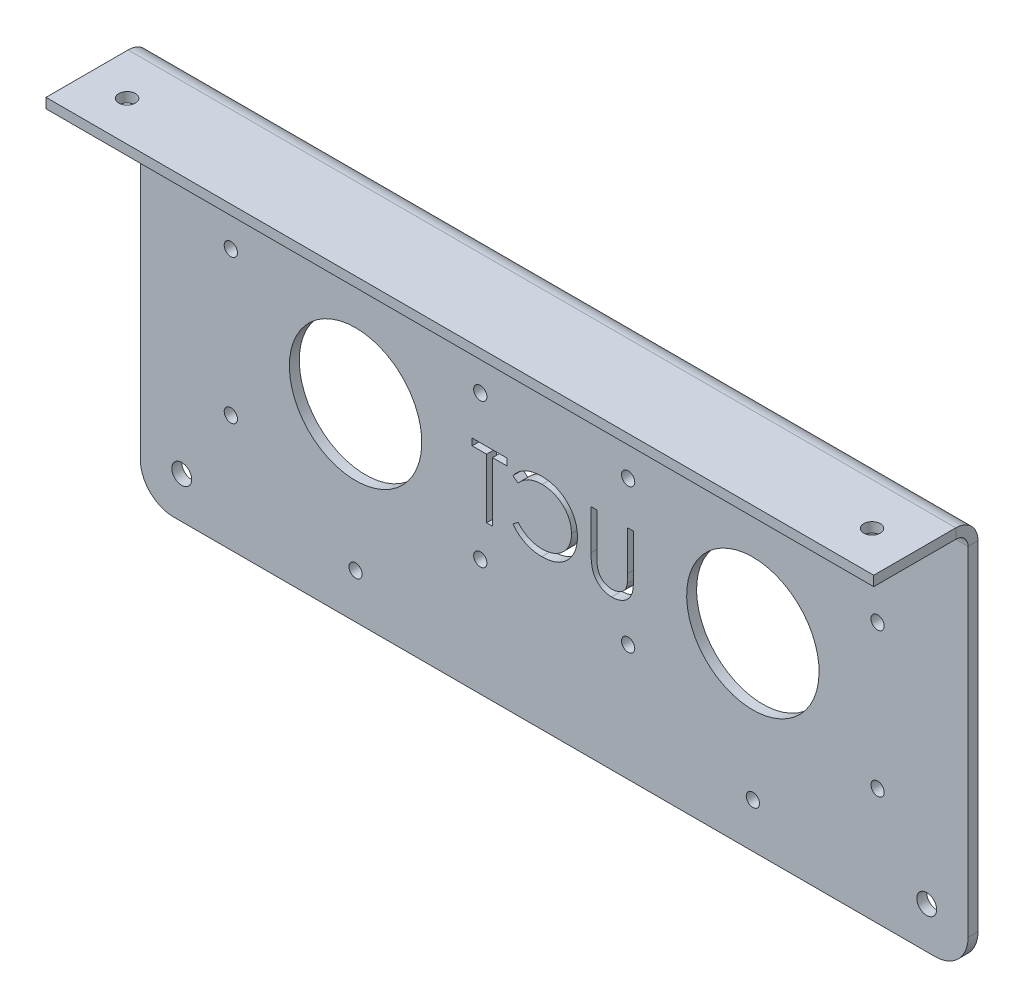
from build123d import *

# Parameters (mm, degrees)
BOSS_EXTRUDE1_DEPTH          = 125
SKETCH2_R                    = 2
SKETCH2_R_2                  = 20
CUT_EXTRUDE1_DEPTH           = 144.272685813
FILLET1_R                    = 10
SKETCH3_R                    = 2.5
CUT_EXTRUDE2_DEPTH           = 10
SKETCH4_R                    = 2.5
CUT_EXTRUDE3_DEPTH           = 10
BASE_FLANGE1_START           = -3
BASE_FLANGE1_DEPTH           = 3
EDGE_FLANGE1_STRIP_W         = 19.4
EDGE_FLANGE1_STRIP_H         = 3
EDGE_FLANGE1_STRIP_CUT_DEPTH = 250
EDGE_FLANGE1_DEPTH           = 250
SKETCH18_R                   = 3
SKETCH18_R_2                 = 2
SKETCH18_R_3                 = 20
CUT_EXTRUDE5_DEPTH           = 10
SKETCH19_R                   = 2.5
CUT_EXTRUDE6_DEPTH           = 10
CUT_EXTRUDE4_DEPTH           = 10


# Read off the part's stored shape, not the designer's step: Base-Flange1
# Sheet-metal steps are written as plain solids
with BuildPart() as part:
    # Sketch1 → Boss-Extrude1 (new, symmetric)
    with BuildSketch(Plane(origin=(0, 0, 0), x_dir=(0, 0, -1), z_dir=(1, 0, 0))):
        with BuildLine():
            Line((-30.75, 61.75), (-5.75, 61.75))
            ThreePointArc((-5.75, 61.75), (-0.093145751, 59.406854249), (2.25, 53.75))
            Line((2.25, 53.75), (2.25, -53.25))
            Line((2.25, -53.25), (-2.25, -53.25))
            Line((-2.25, -53.25), (-2.25, 53.25))
            ThreePointArc((-2.25, 53.25), (-3.421572875, 56.078427125), (-6.25, 57.25))
            Line((-6.25, 57.25), (-30.75, 57.25))
            Line((-30.75, 57.25), (-30.75, 61.75))
        make_face()
    extrude(amount=BOSS_EXTRUDE1_DEPTH, both=True)

    # Sketch2 → Cut-Extrude1 (cut, through all)
    with BuildSketch(Plane(origin=(0, 0, -2.25), x_dir=(-1, 0, 0), z_dir=(0, 0, -1))):
        with Locations(Location((60, 47.25, 0), (0, 0, 90))):
            Circle(SKETCH2_R)
        with Locations(Location((97.672105065, 25.5, 0), (0, 0, 90))):
            Circle(SKETCH2_R)
        with Locations(Location((97.672105065, -18, 0), (0, 0, 90))):
            Circle(SKETCH2_R)
        with Locations(Location((60, -39.75, 0), (0, 0, 90))):
            Circle(SKETCH2_R)
        with Locations(Location((22.327894935, -18, 0), (0, 0, 90))):
            Circle(SKETCH2_R)
        with Locations(Location((22.327894935, 25.5, 0), (0, 0, 90))):
            Circle(SKETCH2_R)
        with Locations(Location((60, 3.75, 0), (0, 0, 90))):
            Circle(SKETCH2_R_2)
        with Locations(Location((-60, 3.75, 0), (0, 0, 90))):
            Circle(SKETCH2_R_2)
        with Locations(Location((-22.327894935, 25.5, 0), (0, 0, 90))):
            Circle(SKETCH2_R)
        with Locations(Location((-22.327894935, -18, 0), (0, 0, 90))):
            Circle(SKETCH2_R)
        with Locations(Location((-60, -39.75, 0), (0, 0, 90))):
            Circle(SKETCH2_R)
        with Locations(Location((-97.672105065, -18, 0), (0, 0, 90))):
            Circle(SKETCH2_R)
        with Locations(Location((-97.672105065, 25.5, 0), (0, 0, 90))):
            Circle(SKETCH2_R)
        with Locations(Location((-60, 47.25, 0), (0, 0, 90))):
            Circle(SKETCH2_R)
    extrude(amount=-CUT_EXTRUDE1_DEPTH, mode=Mode.SUBTRACT)

    # Fillet1
    fillet1_edges = [part.edges().sort_by_distance(p)[0] for p in [
        (125, -53.25, 0),
        (-125, -53.25, 0),
    ]]
    fillet(fillet1_edges, radius=FILLET1_R)

    # Sketch3 → Cut-Extrude2 (cut)
    with BuildSketch(Plane(origin=(0, 61.75, 0), x_dir=(1, 0, 0), z_dir=(0, 1, 0))):
        with Locations(Location((112.5, -17.25, 0), (0, 0, 270))):
            Circle(SKETCH3_R)
        with Locations(Location((-112.5, -17.25, 0), (0, 0, 270))):
            Circle(SKETCH3_R)
    extrude(amount=-CUT_EXTRUDE2_DEPTH, mode=Mode.SUBTRACT)

    # Sketch4 → Cut-Extrude3 (cut)
    with BuildSketch(Plane(origin=(0, 0, -2.25), x_dir=(-1, 0, 0), z_dir=(0, 0, -1))):
        with Locations(Location((112.5, -40.75, 0), (0, 0, 90))):
            Circle(SKETCH4_R)
        with Locations(Location((-112.5, -40.75, 0), (0, 0, 90))):
            Circle(SKETCH4_R)
    extrude(amount=-CUT_EXTRUDE3_DEPTH, mode=Mode.SUBTRACT)


with BuildPart() as body_2:
    # Base-Flange1 outline → Base-Flange1 (new body)
    with BuildSketch(Plane(origin=(0, 0, -2.25), x_dir=(-1, 0, 0), z_dir=(0, 0, -1)).offset(BASE_FLANGE1_START)):
        with BuildLine():
            Line((125, -43.25), (125, 65.75))
            Line((125, 65.75), (-125, 65.75))
            Line((-125, 65.75), (-125, -43.25))
            ThreePointArc((-125, -43.25), (-122.071067812, -50.321067812), (-115, -53.25))
            Line((-115, -53.25), (115, -53.25))
            ThreePointArc((115, -53.25), (122.071067812, -50.321067812), (125, -43.25))
        make_face()
    extrude(amount=BASE_FLANGE1_DEPTH)

    # Edge-Flange1 strip (across the edge) → Edge-Flange1 strip cut (cut)
    with BuildSketch(Plane(origin=(125, 65.75, 0.75), x_dir=(0, -1, 0), z_dir=(-1, 0, 0))):
        with Locations((-3, -1.5)):
            Rectangle(EDGE_FLANGE1_STRIP_W, EDGE_FLANGE1_STRIP_H)
    extrude(amount=EDGE_FLANGE1_STRIP_CUT_DEPTH, mode=Mode.SUBTRACT)

    # Edge-Flange1 section (across the edge) → Edge-Flange1 (add)
    with BuildSketch(Plane(origin=(125, 65.75, 0.75), x_dir=(0, -1, 0), z_dir=(-1, 0, 0))):
        with BuildLine():
            Line((0, 3.7), (0, 28.5))
            Line((0, 28.5), (3, 28.5))
            Line((3, 28.5), (3, 3.7))
            ThreePointArc((3, 3.7), (4.08370491, 1.08370491), (6.7, 0))
            Line((6.7, 0), (6.7, -3))
            ThreePointArc((6.7, -3), (1.962384566, -1.037615434), (0, 3.7))
        make_face()
    extrude(amount=EDGE_FLANGE1_DEPTH)

    # Sketch18 → Cut-Extrude5 (cut)
    with BuildSketch(Plane(origin=(0, 0, -2.25), x_dir=(-1, 0, 0), z_dir=(0, 0, -1))):
        with Locations(Location((-112.5, -40.75, 0), (0, 0, 90))):
            Circle(SKETCH18_R)
        with Locations(Location((97.672105065, -18, 0), (0, 0, 90))):
            Circle(SKETCH18_R_2)
        with Locations(Location((97.672105065, 25.5, 0), (0, 0, 90))):
            Circle(SKETCH18_R_2)
        with Locations(Location((60, 47.25, 0), (0, 0, 90))):
            Circle(SKETCH18_R_2)
        with Locations(Location((-97.672105065, -18, 0), (0, 0, 90))):
            Circle(SKETCH18_R_2)
        with Locations(Location((-60, -39.75, 0), (0, 0, 90))):
            Circle(SKETCH18_R_2)
        with Locations(Location((-22.327894935, -18, 0), (0, 0, 90))):
            Circle(SKETCH18_R_2)
        with Locations(Location((-22.327894935, 25.5, 0), (0, 0, 90))):
            Circle(SKETCH18_R_2)
        with Locations(Location((-60, 3.75, 0), (0, 0, 90))):
            Circle(SKETCH18_R_3)
        with Locations(Location((60, 3.75, 0), (0, 0, 90))):
            Circle(SKETCH18_R_3)
        with Locations(Location((22.327894935, 25.5, 0), (0, 0, 90))):
            Circle(SKETCH18_R_2)
        with Locations(Location((22.327894935, -18, 0), (0, 0, 90))):
            Circle(SKETCH18_R_2)
        with Locations(Location((60, -39.75, 0), (0, 0, 90))):
            Circle(SKETCH18_R_2)
        with Locations(Location((-60, 47.25, 0), (0, 0, 90))):
            Circle(SKETCH18_R_2)
        with Locations(Location((-97.672105065, 25.5, 0), (0, 0, 90))):
            Circle(SKETCH18_R_2)
        with Locations(Location((112.5, -40.75, 0), (0, 0, 90))):
            Circle(SKETCH18_R)
    extrude(amount=-CUT_EXTRUDE5_DEPTH, mode=Mode.SUBTRACT)

    # Sketch19 → Cut-Extrude6 (cut)
    with BuildSketch(Plane(origin=(0, 65.75, 0), x_dir=(1, 0, 0), z_dir=(0, 1, 0))):
        with Locations(Location((-112.5, -17.25, 0), (0, 0, 270))):
            Circle(SKETCH19_R)
        with Locations(Location((112.5, -17.25, 0), (0, 0, 270))):
            Circle(SKETCH19_R)
    extrude(amount=-CUT_EXTRUDE6_DEPTH, mode=Mode.SUBTRACT)

    # Sketch5 → Cut-Extrude4 (cut)
    with BuildSketch(Plane(origin=(0, 0, -2.25), x_dir=(-1, 0, 0), z_dir=(0, 0, -1))):
        with BuildLine():
            Line((-23.935897436, 12.5), (-22.141025641, 12.5))
            Line((-22.141025641, 12.5), (-22.141025641, 0.516826923))
            add(Edge.make_bspline(
                [(-22.141025641, 0.516826923), (-22.141292749, 0.347222719), (-22.141799634, 0.025369513), (-22.13841384, -0.432735061), (-22.128931735, -0.840006256), (-22.12295368, -1.198013956), (-22.109654632, -1.50511537), (-22.098808649, -1.762974288), (-22.084862611, -1.970369731), (-22.068101939, -2.091403594), (-22.060897436, -2.143429487)],
                knots=[0, 0, 0, 0, 1.528628734, 2.90083645, 4.128790002, 5.200304208, 6.127813768, 6.898992206, 7.526736466, 8, 8, 8, 8], degree=3))
            add(Edge.make_bspline(
                [(-22.060897436, -2.143429487), (-22.031311957, -2.331125278), (-21.973808035, -2.695940873), (-21.827257305, -3.215416769), (-21.622585871, -3.683596531), (-21.380054198, -4.115089623), (-21.060439276, -4.497885966), (-20.677561931, -4.850523982), (-20.213688968, -5.158934294), (-19.697914079, -5.440938933), (-19.141998436, -5.667596547), (-18.573934057, -5.8389872), (-18.00225989, -5.943438056), (-17.619538947, -5.955532564), (-17.429487179, -5.961538462)],
                knots=[0, 0, 0, 0, 1.035780045, 2.013197591, 2.933192213, 3.817615948, 4.702609284, 5.640816605, 6.646850145, 7.73207398, 8.84249596, 9.914020372, 10.964143139, 12, 12, 12, 12], degree=3))
            add(Edge.make_bspline(
                [(-17.429487179, -5.961538462), (-17.266322949, -5.955402174), (-16.940936881, -5.943165041), (-16.457471562, -5.867385435), (-15.986613799, -5.730810774), (-15.526038485, -5.554583583), (-15.094318574, -5.321740206), (-14.691213191, -5.05276398), (-14.331419281, -4.73727326), (-14.003087865, -4.388128434), (-13.717173946, -3.99418672), (-13.469338851, -3.564025931), (-13.266333539, -3.09117252), (-13.166084825, -2.758861536), (-13.114583333, -2.588141026)],
                knots=[0, 0, 0, 0, 0.994687771, 1.983630487, 2.973142513, 3.978332533, 4.983357753, 5.956394766, 6.925816176, 7.893390482, 8.871859704, 9.88551698, 10.913711441, 12, 12, 12, 12], degree=3))
            add(Edge.make_bspline(
                [(-13.114583333, -2.588141026), (-13.09743976, -2.517577744), (-13.05923697, -2.360334315), (-13.023539571, -2.094498369), (-12.986359425, -1.78084486), (-12.960561882, -1.417120216), (-12.935412052, -1.004543229), (-12.920365921, -0.540964615), (-12.913411447, -0.028067696), (-12.911338988, 0.329858943), (-12.91025641, 0.516826923)],
                knots=[0, 0, 0, 0, 0.558680831, 1.244966039, 2.062412453, 2.990489873, 4.051219941, 5.244515665, 6.560634259, 8, 8, 8, 8], degree=3))
            Line((-12.91025641, 0.516826923), (-12.91025641, 12.5))
            Line((-12.91025641, 12.5), (-11.115384615, 12.5))
            Line((-11.115384615, 12.5), (-11.115384615, 0.420673077))
            add(Edge.make_bspline(
                [(-11.115384615, 0.420673077), (-11.116836732, 0.202968054), (-11.119670625, -0.221896534), (-11.144245348, -0.844475728), (-11.183428205, -1.435064193), (-11.238788707, -1.993741316), (-11.312143011, -2.51850794), (-11.3937157, -3.013963758), (-11.497598746, -3.476552288), (-11.618932467, -3.909880388), (-11.757638456, -4.322369036), (-11.93730216, -4.713846834), (-12.139727874, -5.096214832), (-12.379811605, -5.46368974), (-12.649590935, -5.817898615), (-12.95502911, -6.15669333), (-13.286024315, -6.48548788), (-13.648078942, -6.795848258), (-14.0352248, -7.080469269), (-14.446310273, -7.330742246), (-14.878177528, -7.542305775), (-15.329703963, -7.716453914), (-15.801082266, -7.847394481), (-16.292324321, -7.9449668), (-16.804548283, -8.0004085), (-17.152917747, -8.0086481), (-17.329326923, -8.012820513)],
                knots=[0, 0, 0, 0, 1.316592851, 2.569410997, 3.76748051, 4.895814652, 5.963796859, 6.97159953, 7.931736103, 8.829262218, 9.692595152, 10.560224239, 11.431080259, 12.30701507, 13.211635791, 14.121146779, 15.063487852, 16.031507147, 17.00238618, 17.966455255, 18.938106653, 19.907068911, 20.888905087, 21.893141452, 22.933117798, 24, 24, 24, 24], degree=3))
            add(Edge.make_bspline(
                [(-17.329326923, -8.012820513), (-17.521721795, -8.00833614), (-17.899199846, -7.999537816), (-18.455417373, -7.949122101), (-18.988641352, -7.854159848), (-19.504503506, -7.733245884), (-19.995980633, -7.566481671), (-20.469657458, -7.371635243), (-20.91742135, -7.132336613), (-21.346536371, -6.866088653), (-21.745534977, -6.566519292), (-22.111805852, -6.240004012), (-22.445953684, -5.891773284), (-22.742346235, -5.518056908), (-23.005894147, -5.12176144), (-23.232923938, -4.701765784), (-23.427856761, -4.258232548), (-23.528465716, -3.949928546), (-23.579326923, -3.794070513)],
                knots=[0, 0, 0, 0, 1.13879206, 2.234305948, 3.301075583, 4.341971843, 5.366689343, 6.369221514, 7.369726634, 8.367512178, 9.355451585, 10.318319045, 11.268648973, 12.207971039, 13.137398894, 14.081662264, 15.030215811, 16, 16, 16, 16], degree=3))
            add(Edge.make_bspline(
                [(-23.579326923, -3.794070513), (-23.608910684, -3.687598659), (-23.673078521, -3.456658836), (-23.741794507, -3.07445033), (-23.799560688, -2.634365087), (-23.853878163, -2.136372982), (-23.885929352, -1.58008803), (-23.914029001, -0.965751368), (-23.936095395, -0.292620158), (-23.935965267, 0.176262789), (-23.935897436, 0.420673077)],
                knots=[0, 0, 0, 0, 0.625038921, 1.35572334, 2.194682327, 3.136881307, 4.189498639, 5.346923369, 6.617055217, 8, 8, 8, 8], degree=3))
            Line((-23.935897436, 0.420673077), (-23.935897436, 12.5))
        make_face()
        with BuildLine():
            Line((12.474358974, 8.830128205), (10.903846154, 7.628205128))
            add(Edge.make_bspline(
                [(10.903846154, 7.628205128), (10.791812506, 7.761724956), (10.569255667, 8.026964474), (10.211203081, 8.399419014), (9.838050836, 8.748363365), (9.449941572, 9.07545982), (9.039889461, 9.36926991), (8.617827754, 9.645104784), (8.176696067, 9.892349001), (7.566686155, 10.192137493), (6.76869845, 10.504972664), (5.764156513, 10.767276843), (4.715521664, 10.93425499), (4.000106809, 10.952339798), (3.636217949, 10.961538462)],
                knots=[0, 0, 0, 0, 0.757959112, 1.505699292, 2.245454638, 2.979532153, 3.711538275, 4.438200793, 5.171680507, 5.909471876, 7.393775596, 8.890124382, 10.418191784, 12, 12, 12, 12], degree=3))
            add(Edge.make_bspline(
                [(3.636217949, 10.961538462), (3.435741952, 10.959230104), (3.036650566, 10.954634814), (2.444373575, 10.894011241), (1.86315614, 10.808804327), (1.293376333, 10.682373908), (0.735759427, 10.522530371), (0.186659987, 10.331528005), (-0.345972012, 10.095214635), (-0.869504802, 9.834024578), (-1.371100293, 9.539010608), (-1.845700566, 9.217220026), (-2.291574669, 8.87225376), (-2.70907531, 8.502818867), (-3.0986293, 8.110579092), (-3.457413933, 7.691354283), (-3.784187706, 7.24648472), (-4.085427849, 6.781836677), (-4.355214897, 6.298763582), (-4.581099922, 5.795477465), (-4.781129192, 5.280596877), (-4.939410579, 4.748304529), (-5.064693532, 4.202345867), (-5.151137322, 3.64125565), (-5.211071443, 3.066206053), (-5.215643883, 2.676438552), (-5.217948718, 2.479967949)],
                knots=[0, 0, 0, 0, 1.054917814, 2.100044995, 3.131103042, 4.146048494, 5.169673617, 6.183595914, 7.203665975, 8.234915748, 9.262203917, 10.264457458, 11.251630812, 12.227803204, 13.197192746, 14.159520551, 15.12972552, 16.100847026, 17.073214652, 18.039054194, 19.002613845, 19.979014051, 20.95965708, 21.949030935, 22.966165397, 24, 24, 24, 24], degree=3))
            add(Edge.make_bspline(
                [(-5.217948718, 2.479967949), (-5.210738324, 2.184360406), (-5.19658167, 1.603974207), (-5.07059119, 0.753856433), (-4.879133526, -0.060547418), (-4.592187372, -0.834146516), (-4.238364226, -1.576479991), (-3.791275017, -2.274987725), (-3.273466232, -2.940225236), (-2.677612407, -3.556470652), (-2.023864887, -4.119406225), (-1.322448249, -4.615123834), (-0.575109462, -5.028351734), (0.209899854, -5.372214285), (1.038620505, -5.636538443), (1.909562233, -5.822619149), (2.820830777, -5.944003038), (3.443513062, -5.955624112), (3.760416667, -5.961538462)],
                knots=[0, 0, 0, 0, 1.029171465, 2.020641659, 2.987623507, 3.938342917, 4.889210282, 5.84687017, 6.821220943, 7.821438502, 8.827599549, 9.822697543, 10.807740252, 11.797342354, 12.80366471, 13.83203677, 14.896651826, 16, 16, 16, 16], degree=3))
            add(Edge.make_bspline(
                [(3.760416667, -5.961538462), (4.109574889, -5.951888292), (4.796801798, -5.932894448), (5.804619091, -5.771984453), (6.769394895, -5.511082066), (7.691181103, -5.145951081), (8.567379082, -4.671292293), (9.399359998, -4.095875851), (10.187826115, -3.414228235), (10.661947728, -2.893753216), (10.903846154, -2.628205128)],
                knots=[0, 0, 0, 0, 1.028121516, 2.023589091, 2.998037872, 3.967518031, 4.937445131, 5.927275754, 6.942489185, 8, 8, 8, 8], degree=3))
            Line((10.903846154, -2.628205128), (12.474358974, -3.818108974))
            add(Edge.make_bspline(
                [(12.474358974, -3.818108974), (12.347969775, -3.981185842), (12.095796774, -4.30655845), (11.687465248, -4.765253934), (11.257309263, -5.196705565), (10.802133777, -5.597434829), (10.327174968, -5.975460347), (9.823904612, -6.32004224), (9.298938712, -6.63599015), (8.754055975, -6.925286862), (8.18983533, -7.181956845), (7.606952845, -7.401692661), (7.007920985, -7.590977744), (6.392712366, -7.746703097), (5.760050898, -7.868252147), (5.112219617, -7.949507432), (4.44782033, -8.005175515), (3.999583638, -8.010249319), (3.772435897, -8.012820513)],
                knots=[0, 0, 0, 0, 0.986787822, 1.968848986, 2.935600012, 3.899624008, 4.868462664, 5.837806735, 6.815139263, 7.798259679, 8.787526145, 9.778297419, 10.776456485, 11.791383307, 12.812564526, 13.85620153, 14.913611965, 16, 16, 16, 16], degree=3))
            add(Edge.make_bspline(
                [(3.772435897, -8.012820513), (3.557329229, -8.011323413), (3.131982428, -8.008363082), (2.503989562, -7.96040784), (1.892620528, -7.894980772), (1.299622666, -7.796465737), (0.721759952, -7.680212365), (0.164270898, -7.524376613), (-0.378330304, -7.349809947), (-0.90386368, -7.144638594), (-1.41277625, -6.913117551), (-1.903426601, -6.6514515), (-2.375589072, -6.361840845), (-2.833905762, -6.050669357), (-3.27160624, -5.707941917), (-3.692483528, -5.338418292), (-4.098897678, -4.943343945), (-4.350341592, -4.658459068), (-4.476762821, -4.515224359)],
                knots=[0, 0, 0, 0, 1.114604814, 2.203992996, 3.262667896, 4.300477797, 5.318619304, 6.316056647, 7.298880507, 8.271930387, 9.238335007, 10.195173496, 11.151986948, 12.108099108, 13.064862484, 14.031167946, 15.010108607, 16, 16, 16, 16], degree=3))
            add(Edge.make_bspline(
                [(-4.476762821, -4.515224359), (-4.679252212, -4.266417565), (-5.081786365, -3.771807791), (-5.596790271, -2.970173613), (-6.037633444, -2.133212419), (-6.394067277, -1.256527112), (-6.672711466, -0.342084899), (-6.865746867, 0.610575183), (-6.991184607, 1.600563424), (-7.005529114, 2.273916502), (-7.012820513, 2.616185897)],
                knots=[0, 0, 0, 0, 0.994628077, 1.977248131, 2.950237994, 3.925870899, 4.908910175, 5.911660606, 6.938484602, 8, 8, 8, 8], degree=3))
            add(Edge.make_bspline(
                [(-7.012820513, 2.616185897), (-7.003933692, 2.975931346), (-6.986449428, 3.683708058), (-6.837902026, 4.722416363), (-6.598937476, 5.717567213), (-6.259526684, 6.667302896), (-5.829210391, 7.576618784), (-5.29762974, 8.438568526), (-4.670960356, 9.258664524), (-3.954117112, 10.024463102), (-3.168018053, 10.724687975), (-2.32619626, 11.340723425), (-1.43029942, 11.853394945), (-0.49019741, 12.281944444), (0.501149341, 12.611341376), (1.541625736, 12.841931014), (2.629276678, 12.985457393), (3.371347682, 13.003601438), (3.748397436, 13.012820513)],
                knots=[0, 0, 0, 0, 1.032925535, 2.032216505, 3.007276963, 3.968222605, 4.92396291, 5.891752235, 6.871517503, 7.883894988, 8.900124299, 9.891468569, 10.874487609, 11.85992873, 12.854644235, 13.869047385, 14.917252991, 16, 16, 16, 16], degree=3))
            add(Edge.make_bspline(
                [(3.748397436, 13.012820513), (3.978194418, 13.010065437), (4.433054403, 13.004612043), (5.105926702, 12.951434088), (5.761025714, 12.86278491), (6.398802754, 12.742121654), (7.022360561, 12.592365531), (7.626933366, 12.397278112), (8.216068719, 12.174212219), (8.786051052, 11.917306699), (9.334145624, 11.62892532), (9.86018173, 11.312264614), (10.359980922, 10.967717154), (10.837060056, 10.598213294), (11.283438405, 10.195935813), (11.711789711, 9.77194955), (12.107567301, 9.314041983), (12.351871272, 8.991728075), (12.474358974, 8.830128205)],
                knots=[0, 0, 0, 0, 1.096760587, 2.17092713, 3.219439832, 4.250915756, 5.268269357, 6.278326846, 7.281116186, 8.274029601, 9.260640565, 10.235837813, 11.203064059, 12.156899882, 13.114053108, 14.069676657, 15.032185724, 16, 16, 16, 16], degree=3))
        make_face()
        Polygon((14.269230769, 10.448717949), (14.269230769, 12.5), (24.782051282, 12.5), (24.782051282, 10.448717949), (20.423076923, 10.448717949), (20.423076923, -7.5), (18.628205128, -7.5), (18.628205128, 10.448717949), align=None)
    extrude(amount=-CUT_EXTRUDE4_DEPTH, mode=Mode.SUBTRACT)


solid = body_2.part
